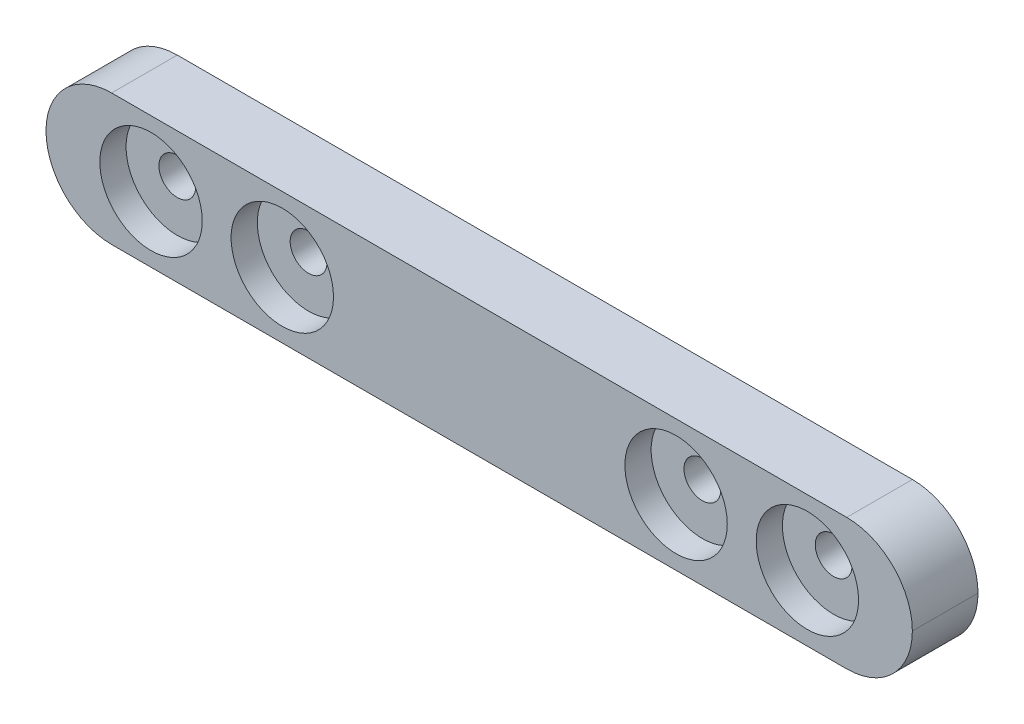
from build123d import *

# Parameters (mm, degrees)
SKETCH1_W               = 66
SKETCH1_H               = 72
BOSS_EXTRUDE1_DEPTH     = 10
SKETCH2_R               = 1.4
CUT_EXTRUDE1_DEPTH      = 10
CUT_EXTRUDE2_DEPTH      = 50.849774322
CUT_EXTRUDE2_DEPTH_BACK = 50.849774322
SKETCH3_W               = 30
SKETCH3_H               = 5
SKETCH5_R               = 7.5
BOSS_EXTRUDE2_DEPTH     = 1.5
SKETCH6_W               = 67
SKETCH6_H               = 25
CUT_EXTRUDE4_DEPTH      = 77.054256949
FILLET1_R               = 5
SKETCH7_R               = 3.9
SKETCH7_R_2             = 1.4
CUT_EXTRUDE5_DEPTH      = 2


with BuildPart() as part:
    # Sketch1 → Boss-Extrude1 (new body)
    with BuildSketch(Plane(origin=(0, 0, 0), x_dir=(1, 0, 0), z_dir=(0, 1, 0))):
        Rectangle(SKETCH1_W, SKETCH1_H)
    extrude(amount=BOSS_EXTRUDE1_DEPTH)

    # Sketch2 → Cut-Extrude1 (cut)
    with BuildSketch(Plane.XY.offset(36)):
        with Locations((-15, 5)):
            Circle(SKETCH2_R)
        with Locations((15, 5)):
            Circle(SKETCH2_R)
        with Locations((-25, 5)):
            Circle(SKETCH2_R)
        with Locations((25, 5)):
            Circle(SKETCH2_R)
    cut_extrude1 = extrude(amount=-CUT_EXTRUDE1_DEPTH, mode=Mode.SUBTRACT)

    # Mirror1: Cut-Extrude1 across plane
    add(cut_extrude1.mirror(Plane.XY), mode=Mode.SUBTRACT)

    # Sketch3 → Cut-Extrude2 (cut, two sides: drawn at the far end of the back side and taken through both)
    with BuildSketch(Plane(origin=(0, 10, 0), x_dir=(1, 0, 0), z_dir=(0, 1, 0)).offset(-CUT_EXTRUDE2_DEPTH_BACK)):
        with Locations((0, -19)):
            Rectangle(SKETCH3_W, SKETCH3_H)
        with Locations((0, 19)):
            Rectangle(SKETCH3_W, SKETCH3_H)
    extrude(amount=CUT_EXTRUDE2_DEPTH + CUT_EXTRUDE2_DEPTH_BACK, mode=Mode.SUBTRACT)

    # Sketch5 → Boss-Extrude2 (add)
    with BuildSketch(Plane(origin=(0, 10, 0), x_dir=(1, 0, 0), z_dir=(0, 1, 0))):
        with Locations(Location((0, 0, 0), (0, 0, 270))):
            Circle(SKETCH5_R)
    extrude(amount=BOSS_EXTRUDE2_DEPTH)

    # Sketch6 → Cut-Extrude4 (cut, through all)
    with BuildSketch(Plane(origin=(33, 0, 0), x_dir=(0, 0, -1), z_dir=(1, 0, 0))):
        with Locations((2.5, 12.5)):
            Rectangle(SKETCH6_W, SKETCH6_H)
    extrude(amount=-CUT_EXTRUDE4_DEPTH, mode=Mode.SUBTRACT)

    # Fillet1
    fillet1_edges = [part.edges().sort_by_distance(p)[0] for p in [
        (33, 0, 33.5),
        (33, 10, 33.5),
        (-33, 0, 33.5),
        (-33, 10, 33.5),
    ]]
    fillet(fillet1_edges, radius=FILLET1_R - 0.0001)  # a hair under: the kernel refuses the full size

    # Sketch7 → Cut-Extrude5 (cut)
    # profile 1 of 4: a face of its own
    with BuildSketch(Plane.XY.offset(36)):
        with Locations((-25, 5)):
            Circle(SKETCH7_R)
        with Locations((-25, 5)):
            Circle(SKETCH7_R_2, mode=Mode.SUBTRACT)
    # profile 2 of 4: a face of its own
    with BuildSketch(Plane.XY.offset(36)):
        with Locations((-15, 5)):
            Circle(SKETCH7_R)
        with Locations((-15, 5)):
            Circle(SKETCH7_R_2, mode=Mode.SUBTRACT)
    # profile 3 of 4: a face of its own
    with BuildSketch(Plane.XY.offset(36)):
        with Locations((15, 5)):
            Circle(SKETCH7_R)
        with Locations((15, 5)):
            Circle(SKETCH7_R_2, mode=Mode.SUBTRACT)
    # profile 4 of 4: a face of its own
    with BuildSketch(Plane.XY.offset(36)):
        with Locations((25, 5)):
            Circle(SKETCH7_R)
        with Locations((25, 5)):
            Circle(SKETCH7_R_2, mode=Mode.SUBTRACT)
    extrude(amount=-CUT_EXTRUDE5_DEPTH, mode=Mode.SUBTRACT)


solid = part.part
